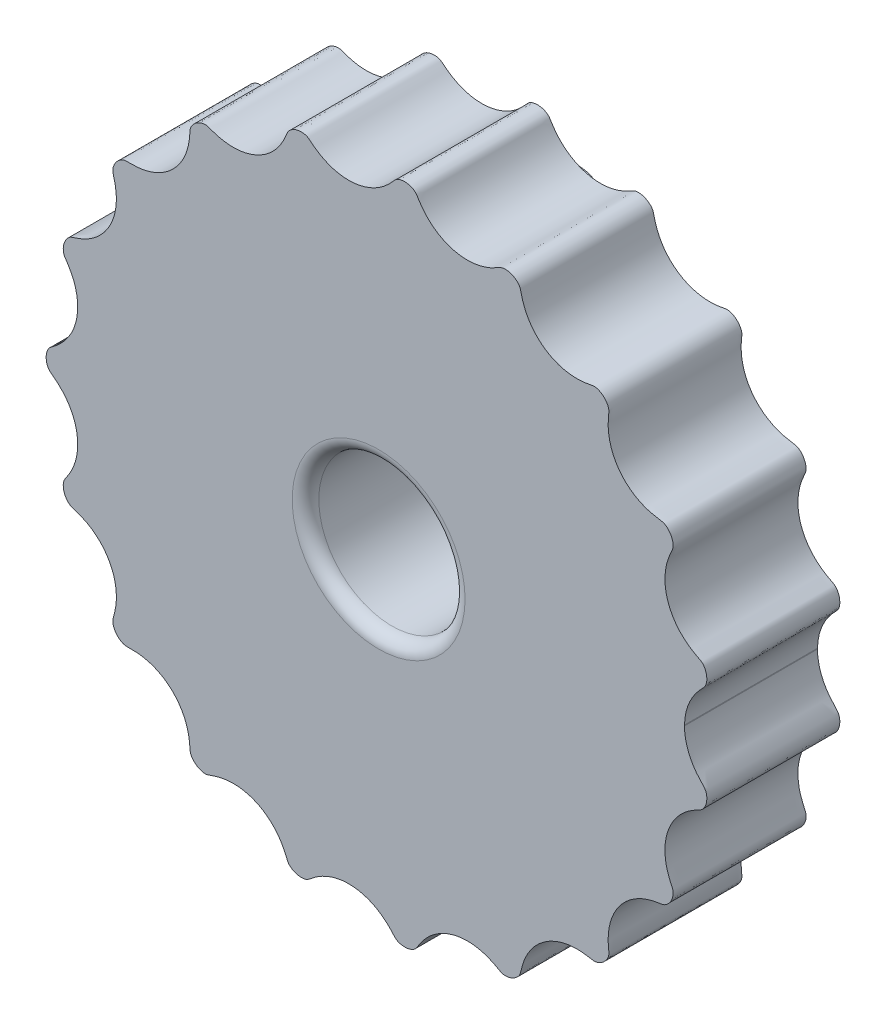
from build123d import *
from OCP.BRepAlgoAPI import BRepAlgoAPI_Cut
from OCP.TopTools import TopTools_ListOfShape

# Parameters (mm, degrees)
SKIZZE1_R                        = 25
AUFSATZ_LINEAR_AUSTRAGEN1_DEPTH  = 10
SCHNITT_LINEAR_AUSTRAGEN1_REACH  = 38.742
SKIZZE3_R                        = 0.5
SKIZZE9_OUTSIDE_W                = 66.282
SKIZZE9_OUTSIDE_H                = 66.277
SCHNITT_LINEAR_AUSTRAGEN6_DEPTH  = 10
SKIZZE21_R                       = 5.5
SCHNITT_LINEAR_AUSTRAGEN11_DEPTH = 10
SKIZZE22_R                       = 2.5
AUFSATZ_LINEAR_AUSTRAGEN2_DEPTH  = 5
VERRUNDUNG1_R                    = 1


with BuildPart() as part:
    # Skizze1 → Aufsatz-Linear austragen1 (new body)
    with BuildSketch(Plane.XY):
        Circle(SKIZZE1_R)
    extrude(amount=AUFSATZ_LINEAR_AUSTRAGEN1_DEPTH)

    # Skizze3 → Schnitt-Linear austragen1 (cut, up to next)
    with BuildSketch(Plane.XY.offset(10), mode=Mode.PRIVATE) as schnitt_linear_austragen1_sk1:
        with Locations((0, 25)):
            Circle(SKIZZE3_R)
    schnitt_linear_austragen1_tool1 = extrude(schnitt_linear_austragen1_sk1.sketch, amount=-SCHNITT_LINEAR_AUSTRAGEN1_REACH, mode=Mode.PRIVATE) & part.part
    add(schnitt_linear_austragen1_tool1.solids().sort_by_distance((0, 25, 10))[0], mode=Mode.SUBTRACT)


with BuildPart() as schnitt_linear_austragen6_tool:
    # Skizze9 outside → Schnitt-Linear austragen6 (new body)
    with BuildSketch(Plane.XY.offset(10)):
        with Locations((0, -0.0025)):
            Rectangle(SKIZZE9_OUTSIDE_W, SKIZZE9_OUTSIDE_H)
        with BuildLine():
            Line((23.000445052, 0.060937419), (23, 0))
            add(Edge.make_bspline(
                [(23, 0), (23, -0.044349008), (23.001634544, -0.133544535), (23.008990115, -0.322210424), (23.028574614, -0.495064366), (23.065190093, -0.760458288), (23.128344661, -1.048281187), (23.256601687, -1.483985708), (23.455853251, -1.931799386), (23.680914036, -2.313218321), (23.909870513, -2.622445518), (24.07431226, -2.824110253), (24.206727121, -2.972267331), (24.333633451, -3.108358174), (24.446736551, -3.225635305), (24.524022768, -3.315918282), (24.582950142, -3.415606662), (24.624575555, -3.520829648), (24.663833231, -3.668623209), (24.685212658, -3.860905388), (24.673454969, -4.086945135), (24.620520353, -4.306815249), (24.546445793, -4.484777086), (24.469451436, -4.614376883), (24.403672696, -4.702418772), (24.331050319, -4.778425537), (24.251571347, -4.839472504), (24.137679259, -4.903870311), (24.000097219, -4.973956943), (23.84602848, -5.056457749), (23.635223866, -5.176178294), (23.393295921, -5.329179221), (23.121190787, -5.527614354), (22.83161764, -5.779890288), (22.56554989, -6.056903088), (22.261697169, -6.436060568), (21.954792305, -6.933189392), (21.724897296, -7.481107687), (21.582883975, -8.065310431), (21.527316325, -8.563551076), (21.521604829, -8.970764731), (21.554125075, -9.36939933), (21.621771537, -9.756104532), (21.708688359, -10.081815143), (21.799454454, -10.348274513), (21.884205293, -10.563157843), (21.95582729, -10.729022258), (22.024783379, -10.882887471), (22.092422873, -11.024820073), (22.140398235, -11.174553681), (22.150406377, -11.346817537), (22.12742522, -11.544222174), (22.061014784, -11.76185876), (21.950504113, -11.978770955), (21.808294479, -12.167418182), (21.661405911, -12.302203337), (21.524713944, -12.391379973), (21.414032836, -12.43721046), (21.330064744, -12.458579008), (21.232109488, -12.476052218), (21.121185626, -12.492228868), (20.992061937, -12.512135255), (20.837428097, -12.539026465), (20.676348543, -12.570851463), (20.465515415, -12.619761983), (20.12052129, -12.717519847), (19.653901317, -12.897202897), (19.089906306, -13.210945732), (18.495681708, -13.693863685), (17.979768758, -14.303268377), (17.581791087, -15.018361732), (17.359944866, -15.712485613), (17.275839331, -16.272804376), (17.257885306, -16.675733613), (17.260289119, -16.912297659), (17.268312239, -17.087096877), (17.280219561, -17.249790236), (17.292103623, -17.381570247), (17.303701486, -17.494353717), (17.312264608, -17.59519884), (17.314827323, -17.684032965), (17.303731872, -17.784796247), (17.272764928, -17.89463724), (17.214331446, -18.035197831), (17.115684868, -18.199184234), (16.97055355, -18.369748736), (16.774094974, -18.530559906), (16.563256223, -18.644549245), (16.377147805, -18.704141919), (16.228010898, -18.718256331), (16.102397709, -18.706443721), (15.982650488, -18.684743591), (15.837019497, -18.658148732), (15.66401259, -18.629235343), (15.482546813, -18.604172907), (15.250492461, -18.580238466), (14.967572009, -18.565542892), (14.542882776, -18.572942029), (14.069257686, -18.636089462), (13.604258599, -18.755934349), (13.066613534, -18.966719819), (12.627823596, -19.205194372), (12.214900787, -19.503646661), (11.838876435, -19.858554155), (11.558257701, -20.183825318), (11.315746611, -20.530340865), (11.111529005, -20.892984657), (10.966201461, -21.21922683), (10.864967944, -21.499403505), (10.794070352, -21.732891274), (10.751061312, -21.893706864), (10.716991714, -22.032228461), (10.686714115, -22.158984424), (10.6596415, -22.274087772), (10.613482868, -22.409752989), (10.527338836, -22.535688011), (10.427360762, -22.644235621), (10.291112437, -22.758327008), (10.126481227, -22.862491763), (9.947040294, -22.939957105), (9.758065088, -22.988506338), (9.580990884, -23.009043361), (9.446037355, -23.007367015), (9.322218618, -22.98832781), (9.214984001, -22.94936695), (9.136712494, -22.910504045), (9.037412358, -22.855573454), (8.916331447, -22.786743456), (8.770400294, -22.708163136), (8.599394122, -22.621424072), (8.296890057, -22.482075538), (7.936423258, -22.348806181), (7.514581595, -22.240173425), (7.031331339, -22.175898472), (6.63282472, -22.160659511), (6.229783332, -22.183593355), (5.826015405, -22.24628189), (5.425311076, -22.349560047), (5.032027225, -22.494084861), (4.656518257, -22.676660873), (4.302267209, -22.894831043), (3.975506648, -23.142933834), (3.677721892, -23.416820254), (3.44405137, -23.674800098), (3.263982058, -23.904047687), (3.127014139, -24.097398487), (3.026037187, -24.249605204), (2.943370251, -24.379361317), (2.877121162, -24.486036845), (2.810740935, -24.57879713), (2.74416189, -24.652300533), (2.654279715, -24.721400662), (2.517169909, -24.800702807), (2.343070205, -24.869762739), (2.128967514, -24.917212113), (1.910391133, -24.925657676), (1.725434514, -24.904879453), (1.559739423, -24.86337266), (1.427196326, -24.812252919), (1.301753294, -24.737435115), (1.191905153, -24.625420932), (1.092920189, -24.51260355), (0.986207514, -24.3949086), (0.871449748, -24.27279856), (0.716656542, -24.117338482), (0.516618525, -23.934026062), (0.194350851, -23.67521298), (-0.281567512, -23.37339053), (-0.887269543, -23.103703015), (-1.633020944, -22.921923215), (-2.411936918, -22.880032942), (-3.183772753, -22.98328489), (-3.829023204, -23.195281934), (-4.2988972, -23.430962009), (-4.616564859, -23.630167647), (-4.823559306, -23.774552149), (-4.97774687, -23.891482046), (-5.119347714, -24.003691962), (-5.242224002, -24.103909003), (-5.336784037, -24.17043694), (-5.438268301, -24.218274505), (-5.542753751, -24.249603187), (-5.686937903, -24.275637376), (-5.871538478, -24.282233578), (-6.086374705, -24.256198966), (-6.293131419, -24.192746417), (-6.459711563, -24.112913075), (-6.600609431, -24.020448435), (-6.711181251, -23.927151216), (-6.796582984, -23.824147974), (-6.850770436, -23.71583568), (-6.898420406, -23.605777644), (-6.947365407, -23.488164192), (-7.008561783, -23.346866721), (-7.084251644, -23.183019072), (-7.185293459, -22.981995225), (-7.317773933, -22.747121988), (-7.49148797, -22.481034064), (-7.715928329, -22.192185427), (-7.968344871, -21.919017194), (-8.248406659, -21.665143187), (-8.561039816, -21.429310586), (-8.999973335, -21.15936401), (-9.485228438, -20.94396874), (-10.005750728, -20.794854161), (-10.5400902, -20.718700851), (-10.966382178, -20.701695058), (-11.385971488, -20.726307169), (-11.744136072, -20.781871828), (-12.040715619, -20.850768976), (-12.280072238, -20.919948378), (-12.464451491, -20.980432418), (-12.618960453, -21.034692841), (-12.744339362, -21.081252299), (-12.843197189, -21.112699229), (-12.914777695, -21.129342332), (-13.015493456, -21.140932804), (-13.160661859, -21.134055928), (-13.345844593, -21.094667271), (-13.56260646, -21.005188433), (-13.772683813, -20.869959052), (-13.946323804, -20.707939025), (-14.067019069, -20.543934653), (-14.143263724, -20.390738491), (-14.177226476, -20.250634214), (-14.186913508, -20.119401386), (-14.198440689, -19.946405008), (-14.213530015, -19.757442916), (-14.235675307, -19.559977047), (-14.274437993, -19.309568767), (-14.348423441, -18.950696656), (-14.498793866, -18.460238452), (-14.782089579, -17.861430032), (-15.234748365, -17.229911899), (-15.812344032, -16.679668351), (-16.491481174, -16.245685384), (-17.151171767, -15.98558094), (-17.688427228, -15.865276912), (-18.07785431, -15.818698105), (-18.344365358, -15.800803267), (-18.55154879, -15.796411929), (-18.747233389, -15.797098718), (-18.919214302, -15.801313033), (-19.042965023, -15.798032434), (-19.158541295, -15.774162573), (-19.263868768, -15.734188884), (-19.3980896, -15.664341865), (-19.552411122, -15.552423471), (-19.709792298, -15.394155651), (-19.835538635, -15.210365782), (-19.917456357, -15.039169872), (-19.969403098, -14.874816471), (-19.994190258, -14.740899926), (-19.994061908, -14.609119869), (-19.96216239, -14.459382142), (-19.920895394, -14.313172891), (-19.877538048, -14.147042514), (-19.822738803, -13.915360041), (-19.770338499, -13.638779931), (-19.729787287, -13.309541458), (-19.715499442, -12.931565797), (-19.734288413, -12.553576969), (-19.78648075, -12.177103437), (-19.872494472, -11.805088171), (-20.023495245, -11.347840311), (-20.235452427, -10.900740033), (-20.506081593, -10.477888045), (-20.831339838, -10.089797059), (-21.129561467, -9.798398433), (-21.449341767, -9.541949139), (-21.785901305, -9.320723048), (-22.090756042, -9.157591612), (-22.354079166, -9.039521408), (-22.57449546, -8.953373927), (-22.748877752, -8.891937388), (-22.912531083, -8.836937192), (-23.066356684, -8.789685219), (-23.212715882, -8.723861285), (-23.348770452, -8.613260744), (-23.480006336, -8.461017062), (-23.595931294, -8.263067795), (-23.680634411, -8.033492463), (-23.722308403, -7.802011304), (-23.721628367, -7.601527638), (-23.693635989, -7.437177019), (-23.645884227, -7.311299551), (-23.58698665, -7.21312039), (-23.50464466, -7.091898831), (-23.413480121, -6.955895234), (-23.316990468, -6.805530999), (-23.195404595, -6.600975755), (-23.068720652, -6.363313462), (-22.938312571, -6.075672915), (-22.783932861, -5.645082693), (-22.656015316, -5.100755854), (-22.599242968, -4.422068125), (-22.682573218, -3.620850866), (-22.927187084, -2.830849576), (-23.281762934, -2.183591871), (-23.6362768, -1.730779958), (-23.922117546, -1.436607135), (-24.101102734, -1.272218319), (-24.239026842, -1.154624124), (-24.371984778, -1.048237606), (-24.482308167, -0.963016223), (-24.57797062, -0.891541044), (-24.661991507, -0.827034417), (-24.732333337, -0.767244059), (-24.800898907, -0.690159367), (-24.861333187, -0.593231274), (-24.925032547, -0.457300089), (-24.978883512, -0.278375099), (-25.007975239, -0.061527264), (-24.998029137, 0.156872346), (-24.961603162, 0.339906687), (-24.906642074, 0.50012632), (-24.850441317, 0.615615614), (-24.783182463, 0.713841399), (-24.70612467, 0.790339655), (-24.641199481, 0.843342445), (-24.554870828, 0.908952697), (-24.448719227, 0.988664196), (-24.324236971, 1.08551779), (-24.183292784, 1.201125684), (-24.010485379, 1.353122041), (-23.81108179, 1.546943796), (-23.594560374, 1.787959427), (-23.371493508, 2.082915142), (-23.173407473, 2.397599431), (-23.002579424, 2.730283971), (-22.825060162, 3.168494616), (-22.696921594, 3.643219257), (-22.627743718, 4.144164769), (-22.624177416, 4.661685067), (-22.666363477, 5.09510154), (-22.751865401, 5.517351943), (-22.877747992, 5.924389933), (-23.019278499, 6.262452411), (-23.158709609, 6.535601458), (-23.284362722, 6.752410897), (-23.3882676, 6.916947859), (-23.488830891, 7.070166759), (-23.587535901, 7.210756821), (-23.671246821, 7.356766871), (-23.714168117, 7.530883328), (-23.726069468, 7.730855757), (-23.699502836, 7.95346433), (-23.630318379, 8.183104328), (-23.52633356, 8.390805115), (-23.408217078, 8.549040856), (-23.291190018, 8.662484079), (-23.187013266, 8.733895955), (-23.096821148, 8.775794948), (-22.981629081, 8.815868272), (-22.848401699, 8.858322888), (-22.69712753, 8.909663583), (-22.487141415, 8.985853442), (-22.243476665, 9.086475268), (-21.966172973, 9.220958126), (-21.659597337, 9.400507491), (-21.366019488, 9.606283221), (-21.015068462, 9.899172124), (-20.616439007, 10.319113026), (-20.277075182, 10.810519886), (-20.014381412, 11.363643533), (-19.854230856, 11.866250836), (-19.76733511, 12.278862528), (-19.722218727, 12.69227238), (-19.716907846, 13.102353212), (-19.745142047, 13.455174831), (-19.790240094, 13.74942761), (-19.839418258, 13.987801772), (-19.883928641, 14.171816656), (-19.924430221, 14.326336612), (-19.959635946, 14.452042245), (-19.981490611, 14.550865907), (-19.991146558, 14.621917303), (-19.993465617, 14.72171627), (-19.974186216, 14.864320272), (-19.919540962, 15.044506214), (-19.812527244, 15.25216623), (-19.679411984, 15.425448939), (-19.543747518, 15.55574001), (-19.401745818, 15.660735954), (-19.278658713, 15.729274103), (-19.150362589, 15.779380876), (-19.024594963, 15.798486978), (-18.926980599, 15.800538574), (-18.813257446, 15.799080978), (-18.683627696, 15.796922513), (-18.53204173, 15.796944362), (-18.31062943, 15.802325062), (-18.041284621, 15.820863743), (-17.724801817, 15.862809117), (-17.364733963, 15.94101113), (-16.917774924, 16.078626012), (-16.397352611, 16.308512891), (-15.823885698, 16.673447375), (-15.248465863, 17.213007475), (-14.783027937, 17.854203567), (-14.487819371, 18.482693114), (-14.3350991, 18.99858497), (-14.262711958, 19.375130086), (-14.226859149, 19.630575355), (-14.20749639, 19.827410906), (-14.193630668, 20.011616761), (-14.183967321, 20.173300433), (-14.169665264, 20.290528491), (-14.13620014, 20.400514429), (-14.087337219, 20.501498285), (-14.005949224, 20.629435105), (-13.880393847, 20.774171639), (-13.70771107, 20.918241132), (-13.512733191, 21.027567196), (-13.335015199, 21.093885416), (-13.164685419, 21.131095174), (-13.023217422, 21.144361796), (-12.881689292, 21.12758481), (-12.746913763, 21.081662976), (-12.631497009, 21.03976391), (-12.500061398, 20.992972587), (-12.351873906, 20.943093342), (-12.141323701, 20.87807499), (-11.86553961, 20.807502895), (-11.538863443, 20.746804727), (-11.161625373, 20.709663429), (-10.783309446, 20.705631746), (-10.303777308, 20.743163442), (-9.735365541, 20.858384867), (-9.18181952, 21.063324831), (-8.660831733, 21.356277131), (-8.259912327, 21.654194829), (-7.958145103, 21.92757187), (-7.687531539, 22.224301823), (-7.478169682, 22.501251308), (-7.318010029, 22.749249931), (-7.20056761, 22.955585939), (-7.116178939, 23.117827482), (-7.040056142, 23.277507391), (-6.979187413, 23.414280948), (-6.928975482, 23.532232778), (-6.882870247, 23.641734547), (-6.839615539, 23.742450967), (-6.773171762, 23.858311637), (-6.65282957, 23.982657264), (-6.491082256, 24.099618345), (-6.284788497, 24.198233347), (-6.048922103, 24.263470899), (-5.812488054, 24.285813995), (-5.613326656, 24.267901929), (-5.455447069, 24.226628527), (-5.347527378, 24.175192548), (-5.275554517, 24.127519588), (-5.196283273, 24.066745711), (-5.108397036, 23.995456259), (-5.005207665, 23.913288922), (-4.87956659, 23.816992501), (-4.745849829, 23.719619426), (-4.565670719, 23.597260564), (-4.257925449, 23.409520833), (-3.806481978, 23.188277614), (-3.189696877, 22.987508405), (-2.4297018, 22.881184216), (-1.632799656, 22.918771452), (-0.841139522, 23.113533128), (-0.185417958, 23.421013674), (0.279913741, 23.737791045), (0.586090336, 23.99639661), (0.75723351, 24.157626572), (0.879528328, 24.281299661), (0.990419271, 24.399613911), (1.078774774, 24.497056472), (1.153438544, 24.581504203), (1.221511196, 24.655596922), (1.284909504, 24.717121913), (1.365964253, 24.776451302), (1.466534589, 24.827405356), (1.607306031, 24.879028125), (1.791189755, 24.917323788), (2.010918157, 24.927456604), (2.228353918, 24.898176477), (2.407586515, 24.845650382), (2.563497119, 24.775949581), (2.678679926, 24.706441913), (2.777632399, 24.621649165), (2.853019608, 24.522023291), (2.908931221, 24.435321014), (2.974078542, 24.33121551), (3.051284656, 24.211060966), (3.167299359, 24.037823409), (3.331351344, 23.813630352), (3.541173762, 23.562291848), (3.803043157, 23.296719614), (4.086707511, 23.0547537), (4.391118971, 22.837513314), (4.714531329, 22.647175745), (5.143388574, 22.44428436), (5.609939139, 22.289692853), (6.103243803, 22.192847895), (6.613571115, 22.159739929), (7.039969066, 22.175523991), (7.45596771, 22.23304208), (7.857753737, 22.32901848), (8.19346564, 22.442983226), (8.465946947, 22.557985394), (8.684156853, 22.663374396), (8.851360353, 22.751583463), (9.006295735, 22.836489131), (9.148436637, 22.919582058), (9.30082606, 22.986899093), (9.45183871, 23.008270961), (9.59966399, 23.008128279), (9.776752969, 22.984634027), (9.965730297, 22.933371674), (10.144919716, 22.852814285), (10.309053586, 22.745466512), (10.44407308, 22.627824749), (10.53407695, 22.526397212), (10.603175592, 22.421236657), (10.6459465, 22.314934112), (10.669806717, 22.230421269), (10.69653886, 22.119567765), (10.728369147, 21.983278147), (10.769645086, 21.821863909), (10.822364317, 21.636487902), (10.926010427, 21.318121266), (11.074042685, 20.961211254), (11.282430556, 20.575963656), (11.565773855, 20.176091831), (11.827322448, 19.8724018), (12.119436256, 19.592389031), (12.44040703, 19.339697956), (12.876661539, 19.060768141), (13.347404564, 18.841416397), (13.841354543, 18.686544703), (14.346562303, 18.597669529), (14.697822311, 18.569296169), (14.998334673, 18.567816526), (15.242436954, 18.580630094), (15.431926482, 18.598274406), (15.616282199, 18.622023152), (15.795573094, 18.650999392), (15.962851102, 18.680431182), (16.118798238, 18.711409079), (16.263399958, 18.718550064), (16.391914742, 18.695708751), (16.543403207, 18.648374892), (16.712767044, 18.566287549), (16.893222658, 18.439957308), (17.047688615, 18.283639814), (17.157623063, 18.132363306), (17.238699297, 17.981533239), (17.290435538, 17.848540597), (17.318850043, 17.704467195), (17.309288654, 17.547054192), (17.293438171, 17.396783532), (17.279126309, 17.237718302), (17.26723479, 17.070006462), (17.258112105, 16.849933903), (17.259396139, 16.577416432), (17.288600546, 16.163150247), (17.391413432, 15.606121227), (17.607063674, 14.97582132), (17.98278944, 14.304662619), (18.482355126, 13.706633868), (19.081060914, 13.213737282), (19.671334612, 12.886965306), (20.160022126, 12.703434456), (20.519491246, 12.605928218), (20.764371272, 12.552105386), (20.953603627, 12.518237265), (21.13087845, 12.490311557), (21.286821711, 12.467902297), (21.399022085, 12.443218823), (21.502531078, 12.400834029), (21.596296463, 12.345018644), (21.713376754, 12.256098562), (21.843670156, 12.12380665), (21.970236318, 11.946885117), (22.06339444, 11.750449289), (22.117045015, 11.572589064), (22.143556613, 11.405366661), (22.148999212, 11.259824084), (22.129043967, 11.126677452), (22.084453838, 11.01317314), (22.035042439, 10.903006381), (21.981626051, 10.786711836), (21.91903893, 10.645419245), (21.84988298, 10.47817838), (21.770611386, 10.266643879), (21.68784118, 10.008603655), (21.610333735, 9.698628805), (21.550896661, 9.335505546), (21.522392058, 8.962605117), (21.527219116, 8.582673391), (21.578650743, 8.086551566), (21.697244437, 7.584617866), (21.886538483, 7.090537103), (22.145664856, 6.619857546), (22.390928041, 6.266159782), (22.666569586, 5.943750333), (22.967923595, 5.654097849), (23.25030844, 5.429986184), (23.500842393, 5.259692028), (23.712869035, 5.131359544), (23.881370584, 5.03731738), (24.02514823, 4.960864369), (24.143671879, 4.900496862), (24.233172759, 4.849199279), (24.293457338, 4.807893364), (24.370004649, 4.741544045), (24.46329889, 4.629697949), (24.559856625, 4.465993302), (24.640716486, 4.244664413), (24.682999507, 3.997236547), (24.68042987, 3.758616145), (24.640301905, 3.558001792), (24.577641328, 3.397875329), (24.495553822, 3.278627925), (24.404839843, 3.182652043), (24.285118601, 3.056518562), (24.155837943, 2.916518174), (24.025294341, 2.765947581), (23.866886198, 2.565736427), (23.65265004, 2.267267024), (23.441960579, 1.901904987), (23.254560312, 1.474212846), (23.132014183, 1.060832925), (23.07056542, 0.786083879), (23.033498116, 0.534909185), (23.013150116, 0.367843981), (23.003809227, 0.188906137), (23.00106448, 0.103341973), (23.000445052, 0.060937419)],
                knots=[0.061461869, 0.061461869, 0.061461869, 0.061461869, 0.061461869, 0.062481445, 0.063501022, 0.064520599, 0.065540176, 0.067576099, 0.069612021, 0.073551422, 0.075470515, 0.076430061, 0.077389608, 0.078784848, 0.079482469, 0.080180089, 0.080675989, 0.08117189, 0.081811292, 0.082450694, 0.08375265, 0.085055896, 0.086348118, 0.086985531, 0.087622943, 0.088090233, 0.088557523, 0.089098343, 0.089639163, 0.090720802, 0.091672036, 0.09262327, 0.094525737, 0.096489951, 0.098454164, 0.100356812, 0.10225946, 0.10627407, 0.110193456, 0.112266353, 0.11433925, 0.11636582, 0.118392389, 0.12031835, 0.122244311, 0.123154673, 0.124065035, 0.124975397, 0.125885759, 0.126557793, 0.127229826, 0.128129419, 0.129330025, 0.130553094, 0.131784273, 0.133020441, 0.134060738, 0.134556345, 0.135051953, 0.13542865, 0.135805347, 0.136558742, 0.137312136, 0.13806553, 0.138967838, 0.139870147, 0.141674763, 0.145291833, 0.149024214, 0.152819048, 0.157032102, 0.161293195, 0.165413803, 0.167416944, 0.168418515, 0.169420086, 0.17018247, 0.170944853, 0.171707237, 0.172088429, 0.172469621, 0.172982902, 0.173496183, 0.174127309, 0.174758435, 0.17604715, 0.177334859, 0.178622361, 0.179842068, 0.180858382, 0.181239448, 0.181620514, 0.182382646, 0.18330634, 0.184230034, 0.185153729, 0.186077423, 0.188008327, 0.18993923, 0.193707134, 0.195683354, 0.197659574, 0.20156597, 0.203742577, 0.205919184, 0.20806606, 0.210212936, 0.212255549, 0.214298162, 0.215256984, 0.216215807, 0.21717463, 0.217654041, 0.218133452, 0.218844998, 0.219556544, 0.220526996, 0.221172682, 0.221818368, 0.223129836, 0.224442242, 0.225090176, 0.225738109, 0.226716692, 0.227156221, 0.227595749, 0.228035278, 0.228474807, 0.229441441, 0.230408075, 0.231374709, 0.232341343, 0.236155051, 0.238142566, 0.24013008, 0.242156938, 0.244183795, 0.24626956, 0.248355325, 0.25048654, 0.252617754, 0.25467391, 0.256730066, 0.258746558, 0.260763049, 0.261683387, 0.262603725, 0.263524064, 0.264444402, 0.264788533, 0.265132665, 0.265820928, 0.266439844, 0.267058759, 0.268319629, 0.269581881, 0.270836146, 0.271447043, 0.272057939, 0.273020901, 0.273690799, 0.274360697, 0.275205248, 0.276049798, 0.276894349, 0.2777389, 0.279628283, 0.281517665, 0.285218833, 0.289070237, 0.292926287, 0.296908335, 0.300855043, 0.304679262, 0.30654518, 0.307478139, 0.308411098, 0.309767191, 0.310445237, 0.311123283, 0.311606737, 0.312090192, 0.312701594, 0.313312996, 0.314554765, 0.315800337, 0.317040482, 0.317652611, 0.31826474, 0.319193909, 0.319946353, 0.320322575, 0.320698797, 0.321608324, 0.322517851, 0.323427377, 0.324336904, 0.326144367, 0.327951831, 0.329827833, 0.331703834, 0.333633724, 0.335563614, 0.337712362, 0.342077456, 0.344293801, 0.346434782, 0.348575763, 0.35066526, 0.352754757, 0.353732581, 0.354710404, 0.355688228, 0.356666052, 0.357036209, 0.357406366, 0.357776523, 0.35814668, 0.359078007, 0.360317761, 0.361577487, 0.362842327, 0.364094692, 0.365071945, 0.365667398, 0.366262852, 0.366989275, 0.367715697, 0.369168542, 0.370082205, 0.370995868, 0.372823194, 0.376552803, 0.38039774, 0.384282664, 0.388402025, 0.39253995, 0.396544231, 0.398493694, 0.399468425, 0.400443157, 0.401928453, 0.402671102, 0.40341375, 0.403913987, 0.404414225, 0.405044338, 0.405674452, 0.406957862, 0.408242485, 0.409517363, 0.410142295, 0.410767227, 0.411714908, 0.412247239, 0.41277957, 0.413844232, 0.4147777, 0.415711168, 0.417578104, 0.419518186, 0.421458267, 0.423328359, 0.425198451, 0.427172202, 0.429145952, 0.433023392, 0.43514143, 0.437259467, 0.439338207, 0.441416947, 0.443392934, 0.445368921, 0.446300588, 0.447232254, 0.448163921, 0.449095588, 0.449784402, 0.450473216, 0.451382192, 0.452593709, 0.453825325, 0.455063918, 0.456298746, 0.45730289, 0.457852187, 0.458401483, 0.459002613, 0.459603742, 0.460806002, 0.461704818, 0.462603633, 0.464401265, 0.466233534, 0.468065804, 0.471816322, 0.475642391, 0.479892351, 0.484207442, 0.48837624, 0.490424009, 0.491447893, 0.492471777, 0.493274866, 0.494077956, 0.494881045, 0.49528259, 0.495684135, 0.496211548, 0.496738961, 0.497357205, 0.497975449, 0.499231578, 0.500491381, 0.501743384, 0.50236159, 0.502979796, 0.503901788, 0.504323365, 0.504744942, 0.505166519, 0.505588096, 0.506506968, 0.507425839, 0.50834471, 0.509263581, 0.511146457, 0.513029333, 0.514869914, 0.516710496, 0.518634982, 0.520559469, 0.524389865, 0.526592624, 0.528795383, 0.530975029, 0.533154675, 0.535263554, 0.537372432, 0.53835327, 0.539334108, 0.540314945, 0.541295783, 0.542048107, 0.542800431, 0.543686288, 0.544870456, 0.546075751, 0.547288506, 0.548504624, 0.549524184, 0.550040358, 0.550556531, 0.551041008, 0.551525485, 0.55249444, 0.553378094, 0.554261748, 0.556029056, 0.557807622, 0.559586189, 0.561417743, 0.563249298, 0.567012976, 0.571225708, 0.573386361, 0.575547015, 0.577630159, 0.579713304, 0.581758364, 0.583803424, 0.584757415, 0.585711405, 0.586665396, 0.587619386, 0.587980597, 0.588341808, 0.588703018, 0.589064229, 0.589990986, 0.591225742, 0.592481897, 0.59374487, 0.59437508, 0.595005289, 0.596034993, 0.596580579, 0.597126165, 0.597562516, 0.597998867, 0.598871569, 0.599744271, 0.600616973, 0.602464647, 0.60431232, 0.606174746, 0.608037171, 0.611882783, 0.615747661, 0.619804001, 0.623847233, 0.627760176, 0.629667042, 0.630620475, 0.631573908, 0.632960263, 0.63365344, 0.634346617, 0.634839622, 0.635332626, 0.635965359, 0.636598093, 0.63788999, 0.639180695, 0.640471372, 0.641083557, 0.641695743, 0.642695231, 0.643314822, 0.643934412, 0.644554003, 0.645173594, 0.646129545, 0.647085497, 0.648997399, 0.650909523, 0.652821646, 0.654718686, 0.656615725, 0.660595184, 0.664475995, 0.66655082, 0.668625645, 0.670649627, 0.672673608, 0.674635575, 0.675616559, 0.676597542, 0.677459594, 0.678321645, 0.679183697, 0.679614722, 0.680045748, 0.680717948, 0.681390147, 0.682294064, 0.683500503, 0.684729773, 0.685967267, 0.687210114, 0.68825602, 0.68874479, 0.68923356, 0.689613898, 0.689994235, 0.690754909, 0.691515583, 0.692276257, 0.69318362, 0.694090983, 0.695905709, 0.699541039, 0.703294389, 0.707104333, 0.711296015, 0.715529056, 0.719622991, 0.721613785, 0.722609182, 0.723604579, 0.724362502, 0.725120424, 0.725878347, 0.726257308, 0.726636269, 0.727146511, 0.727656752, 0.728277518, 0.728898283, 0.730163027, 0.731428819, 0.732686728, 0.733300114, 0.733913501, 0.734868188, 0.73538728, 0.735906371, 0.736425463, 0.736944554, 0.73786553, 0.738786506, 0.740628457, 0.742543985, 0.744459512, 0.746297797, 0.748136082, 0.750075712, 0.752015342, 0.755850354, 0.758013558, 0.760176761, 0.762308008, 0.764439255, 0.766466447, 0.768493639, 0.769446296, 0.770398953, 0.771351609, 0.772304266, 0.773010518, 0.77371677, 0.774692014, 0.775340978, 0.775989942, 0.777308168, 0.778627356, 0.779278498, 0.779929639, 0.7809117, 0.781353356, 0.781795012, 0.782236668, 0.782678324, 0.783649926, 0.784621528, 0.785593129, 0.786564731, 0.79039886, 0.792397566, 0.794396271, 0.796431969, 0.798467667, 0.800543572, 0.802619477, 0.806855275, 0.808898188, 0.810941102, 0.812947147, 0.813950169, 0.814953191, 0.815868189, 0.816783186, 0.817698184, 0.818613182, 0.819297292, 0.819981402, 0.820603238, 0.821225074, 0.822491763, 0.823759871, 0.825019489, 0.825633476, 0.826247462, 0.827207841, 0.827885659, 0.828563477, 0.829410873, 0.830258269, 0.831105665, 0.83195306, 0.833851593, 0.835750126, 0.839469591, 0.84334196, 0.847211812, 0.851171733, 0.855089792, 0.858887816, 0.860741655, 0.861668574, 0.862595494, 0.863942523, 0.864616038, 0.865289552, 0.865770228, 0.866250904, 0.866865514, 0.867480124, 0.868728307, 0.869980404, 0.871226481, 0.871842593, 0.872458706, 0.873390393, 0.874149913, 0.874529673, 0.874909433, 0.875821436, 0.876733439, 0.877645443, 0.878557446, 0.880375808, 0.88219417, 0.884080941, 0.885967711, 0.887906445, 0.889845178, 0.894123322, 0.896327099, 0.898530875, 0.900658637, 0.902786399, 0.904865784, 0.90694517, 0.907917553, 0.908889936, 0.909862318, 0.910834701, 0.911202796, 0.911570891, 0.911938986, 0.912307081, 0.913242964, 0.914488698, 0.9157545, 0.91702529, 0.918282922, 0.919265523, 0.919863292, 0.920461062, 0.921190028, 0.921918995, 0.923376927, 0.924296159, 0.92521539, 0.927053853, 0.930802192, 0.932735308, 0.934668424, 0.935643402, 0.93661838, 0.937593358, 0.938568336, 0.938568336, 0.938568336, 0.938568336, 0.938568336], degree=4))
        make_face(mode=Mode.SUBTRACT)
    extrude(amount=-SCHNITT_LINEAR_AUSTRAGEN6_DEPTH)


with BuildPart() as part_1:
    add(part.part)

    # Schnitt-Linear austragen6: cut by schnitt_linear_austragen6_tool, with a tolerance
    schnitt_linear_austragen6_stock = TopTools_ListOfShape()
    schnitt_linear_austragen6_stock.Append(part_1.part.wrapped)
    schnitt_linear_austragen6_tools = TopTools_ListOfShape()
    schnitt_linear_austragen6_tools.Append(schnitt_linear_austragen6_tool.part.wrapped)
    schnitt_linear_austragen6_cut = BRepAlgoAPI_Cut()
    schnitt_linear_austragen6_cut.SetArguments(schnitt_linear_austragen6_stock)
    schnitt_linear_austragen6_cut.SetTools(schnitt_linear_austragen6_tools)
    schnitt_linear_austragen6_cut.SetFuzzyValue(0.00001)
    schnitt_linear_austragen6_cut.Build()
    add(Compound.cast(schnitt_linear_austragen6_cut.Shape()).solids(), mode=Mode.REPLACE)

    # Skizze21 → Schnitt-Linear austragen11 (cut)
    with BuildSketch(Plane(origin=(0, 0, 0), x_dir=(-1, 0, 0), z_dir=(0, 0, -1))):
        Circle(SKIZZE21_R)
    extrude(amount=-SCHNITT_LINEAR_AUSTRAGEN11_DEPTH, mode=Mode.SUBTRACT)

    # Skizze22 → Aufsatz-Linear austragen2 (add)
    with BuildSketch(Plane(origin=(0, 0, 0), x_dir=(-1, 0, 0), z_dir=(0, 0, -1))):
        with Locations((0, 15)):
            Circle(SKIZZE22_R)
        with Locations((12.990381057, -7.5)):
            Circle(SKIZZE22_R)
        with Locations((-12.990381057, -7.5)):
            Circle(SKIZZE22_R)
    extrude(amount=AUFSATZ_LINEAR_AUSTRAGEN2_DEPTH)

    # Verrundung1
    verrundung1_edges = [part_1.edges().sort_by_distance(p)[0] for p in [
        (5.5, 0, 0),
        (5.5, 0, 10),
    ]]
    fillet(verrundung1_edges, radius=VERRUNDUNG1_R)


solid = part_1.part
